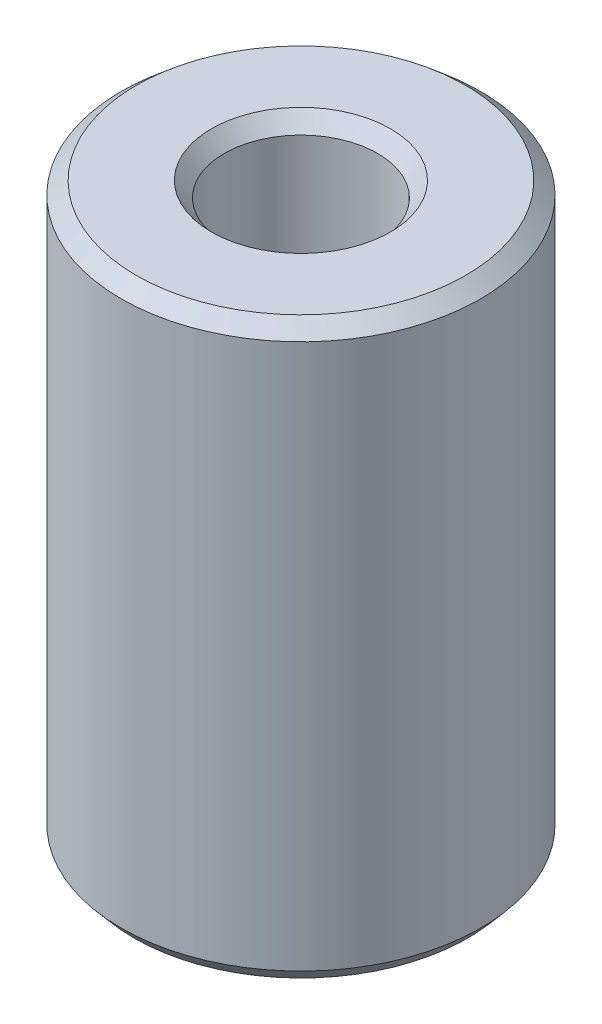
from build123d import *
from OCP.BRepFilletAPI import BRepFilletAPI_MakeChamfer

# Parameters (mm, degrees)
SKETCH1_R           = 42.5
BOSS_EXTRUDE1_DEPTH = 135.474292
SKETCH2_R           = 18.15178768
CUT_EXTRUDE1_DEPTH  = 149.208582048
CHAMFER1_SIZE       = 3.020765676
CHAMFER1_SIZE2      = 3.552463405


with BuildPart() as part:
    # Sketch1 → Boss-Extrude1 (new body)
    with BuildSketch(Plane(origin=(0, 0, 0), x_dir=(1, 0, 0), z_dir=(0, 1, 0))):
        Circle(SKETCH1_R)
    extrude(amount=BOSS_EXTRUDE1_DEPTH)

    # Sketch2 → Cut-Extrude1 (cut, through all)
    with BuildSketch(Plane(origin=(0, 0, 0), x_dir=(1, 0, 0), z_dir=(0, 1, 0))):
        Circle(SKETCH2_R)
    extrude(amount=CUT_EXTRUDE1_DEPTH, mode=Mode.SUBTRACT)

    # Chamfer1: one chamfer whose edges measure the first distance from different faces: ONE call of the kernel's chamfer builder (chamfer() names one face for all edges)
    chamfer1_edges_1 = [part.edges().sort_by_distance(p)[0] for p in [
        (-18.15178768, 135.474292, 0),
    ]]
    chamfer1_side_1 = [part.faces().sort_by_distance(p)[0] for p in [
        (-41.297918472, 135.474292, 0),
    ]]
    chamfer1_edges_2 = [part.edges().sort_by_distance(p)[0] for p in [
        (-18.15178768, 0, 0),
    ]]
    chamfer1_side_2 = [part.faces().sort_by_distance(p)[0] for p in [
        (-18.15178768, 67.737146, 0),
    ]]
    chamfer1_edges_3 = [part.edges().sort_by_distance(p)[0] for p in [
        (-42.5, 0, 0),
    ]]
    chamfer1_side_3 = [part.faces().sort_by_distance(p)[0] for p in [
        (-41.297918472, 0, 0),
    ]]
    chamfer1_edges_4 = [part.edges().sort_by_distance(p)[0] for p in [
        (-42.5, 135.474292, 0),
    ]]
    chamfer1_side_4 = [part.faces().sort_by_distance(p)[0] for p in [
        (-42.5, 67.737146, 0),
    ]]
    chamfer1 = BRepFilletAPI_MakeChamfer(part.part.solid().wrapped)
    for e in chamfer1_edges_1:
        chamfer1.Add(CHAMFER1_SIZE, CHAMFER1_SIZE2, e.wrapped, chamfer1_side_1[0].wrapped)  # the first distance lies on this face
    for e in chamfer1_edges_2:
        chamfer1.Add(CHAMFER1_SIZE, CHAMFER1_SIZE2, e.wrapped, chamfer1_side_2[0].wrapped)  # the first distance lies on this face
    for e in chamfer1_edges_3:
        chamfer1.Add(CHAMFER1_SIZE, CHAMFER1_SIZE2, e.wrapped, chamfer1_side_3[0].wrapped)  # the first distance lies on this face
    for e in chamfer1_edges_4:
        chamfer1.Add(CHAMFER1_SIZE, CHAMFER1_SIZE2, e.wrapped, chamfer1_side_4[0].wrapped)  # the first distance lies on this face
    add(Compound.cast(chamfer1.Shape()), mode=Mode.REPLACE)


solid = part.part
